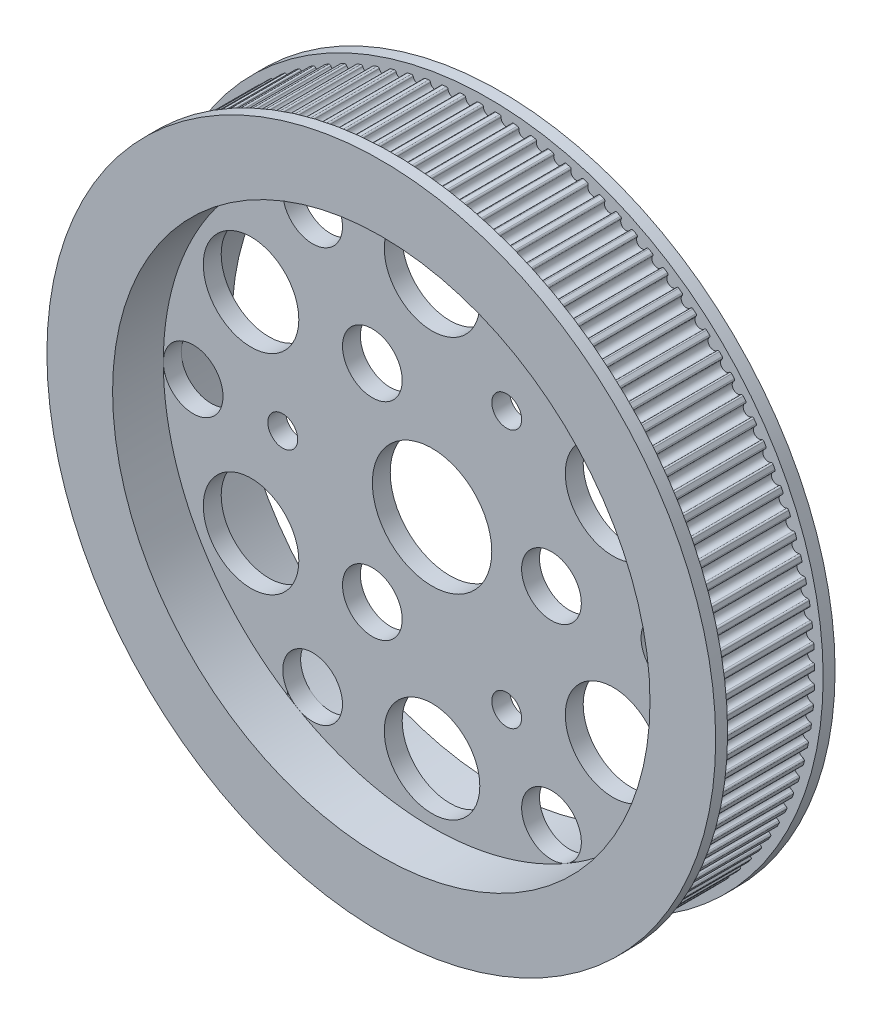
from build123d import *

# Parameters (mm, degrees)
CUT_EXTRUDE_01_DEPTH      = 78.6166518
PATTERN_CIRCULAR_01_COUNT = 115
EXTRUDE_START             = 8
SKETCH_5_R                = 56
EXTRUDE_1_DEPTH           = 2
EXTRUDE_START_2           = -10
SKETCH_5_2_R              = 56
EXTRUDE_2_DEPTH           = 2
CUT_EXTRUDE_START         = 10
SKETCH_7_R                = 45
CUT_EXTRUDE_2_DEPTH       = 8.5
CUT_EXTRUDE_START_2       = -1.5
SKETCH_7_2_R              = 45
CUT_EXTRUDE_3_DEPTH       = 8.5
SKETCH_8_R                = 10
SKETCH_8_R_2              = 2.5
SKETCH_8_R_3              = 5
SKETCH_8_R_4              = 8
CUT_EXTRUDE_4_DEPTH       = 81.026558092


with BuildPart() as part:
    # Sketch 01 → 同步带轮01 (revolve)
    with BuildSketch(Plane(origin=(0, 0, 0), x_dir=(0, 0, -1), z_dir=(1, 0, 0)), mode=Mode.PRIVATE) as revolve_01_sk:
        Polygon((8, 0), (8, 53.408454565), (8, 54.590954547), (6.499927189, 54.590954547), (-6.499927189, 54.590954547), (-8, 54.590954547), (-8, 53.408454565), (-8, 0), align=None)
    revolve(revolve_01_sk.sketch.rotate(Axis((0, 0, 0), (0, 0, 1)), 90), axis=Axis((0, 0, 0), (0, 0, 1)))

    # Sketch 01 2 → 齿拉伸切除同步带轮01 (cut, symmetric)
    with BuildSketch(Plane.XY):
        with BuildLine():
            Line((-1.158133205, 54.578668414), (0, 57.130954509))
            Line((0, 57.130954509), (1.158133205, 54.578668414))
            ThreePointArc((1.158133205, 54.578668414), (0.975940907, 54.506576431), (0.899999986, 54.325954551))
            ThreePointArc((0.899999986, 54.325954551), (0, 53.425954564), (-0.899999986, 54.325954551))
            ThreePointArc((-0.899999986, 54.325954551), (-0.975940907, 54.506576431), (-1.158133205, 54.578668414))
        make_face()
    cut_extrude_01 = extrude(amount=CUT_EXTRUDE_01_DEPTH, both=True, mode=Mode.SUBTRACT)

    # 齿形同步带轮01: 齿拉伸切除同步带轮01 ×115 about axis
    pattern_circular_01_axis = Axis((0, 0, 0), (0, 0, 1))
    for i in range(1, PATTERN_CIRCULAR_01_COUNT):
        add(cut_extrude_01.rotate(pattern_circular_01_axis, i * 360 / PATTERN_CIRCULAR_01_COUNT), mode=Mode.SUBTRACT)

    # 草图5 → 凸台-拉伸1 (add)
    with BuildSketch(Plane.XY.offset(EXTRUDE_START)):
        Circle(SKETCH_5_R)
    extrude(amount=EXTRUDE_1_DEPTH)

    # 草图5<2> → 凸台-拉伸2 (add)
    with BuildSketch(Plane.XY.offset(EXTRUDE_START_2)):
        Circle(SKETCH_5_2_R)
    extrude(amount=EXTRUDE_2_DEPTH)

    # 草图7 → 切除-拉伸2 (cut)
    with BuildSketch(Plane.XY.offset(CUT_EXTRUDE_START)):
        Circle(SKETCH_7_R)
    extrude(amount=-CUT_EXTRUDE_2_DEPTH, mode=Mode.SUBTRACT)

    # 草图7<2> → 切除-拉伸3 (cut)
    with BuildSketch(Plane.XY.offset(CUT_EXTRUDE_START_2)):
        Circle(SKETCH_7_2_R)
    extrude(amount=-CUT_EXTRUDE_3_DEPTH, mode=Mode.SUBTRACT)

    # 草图8 → 切除-拉伸4 (cut, through all)
    with BuildSketch(Plane.XY.offset(1.5)):
        Circle(SKETCH_8_R)
        with Locations((-25, 0)):
            Circle(SKETCH_8_R_2)
        with Locations((12.5, 21.650635095)):
            Circle(SKETCH_8_R_2)
        with Locations((12.5, -21.650635095)):
            Circle(SKETCH_8_R_2)
        with Locations((-10, 17.320508076)):
            Circle(SKETCH_8_R_3)
        with Locations((20, 0)):
            Circle(SKETCH_8_R_3)
        with Locations((-10, -17.320508076)):
            Circle(SKETCH_8_R_3)
        with Locations((-30.310889132, -17.5)):
            Circle(SKETCH_8_R_4)
        with Locations((-30.310889132, 17.5)):
            Circle(SKETCH_8_R_4)
        with Locations((0, 35)):
            Circle(SKETCH_8_R_4)
        with Locations((30.310889132, 17.5)):
            Circle(SKETCH_8_R_4)
        with Locations((30.310889132, -17.5)):
            Circle(SKETCH_8_R_4)
        with Locations((0, -35)):
            Circle(SKETCH_8_R_4)
        with Locations(Location((-20, 34.641016151, 0), (0, 0, 119.99961573))):
            Circle(SKETCH_8_R_3)
        with Locations(Location((20, 34.641016151, 0), (0, 0, 59.999615566))):
            Circle(SKETCH_8_R_3)
        with Locations((40, 0)):
            Circle(SKETCH_8_R_3)
        with Locations(Location((20, -34.641016151, 0), (0, 0, 299.99961573))):
            Circle(SKETCH_8_R_3)
        with Locations(Location((-20, -34.641016151, 0), (0, 0, 239.999615566))):
            Circle(SKETCH_8_R_3)
        with Locations(Location((-40, 0, 0), (0, 0, 179.999615648))):
            Circle(SKETCH_8_R_3)
    extrude(amount=-CUT_EXTRUDE_4_DEPTH, mode=Mode.SUBTRACT)


solid = part.part
